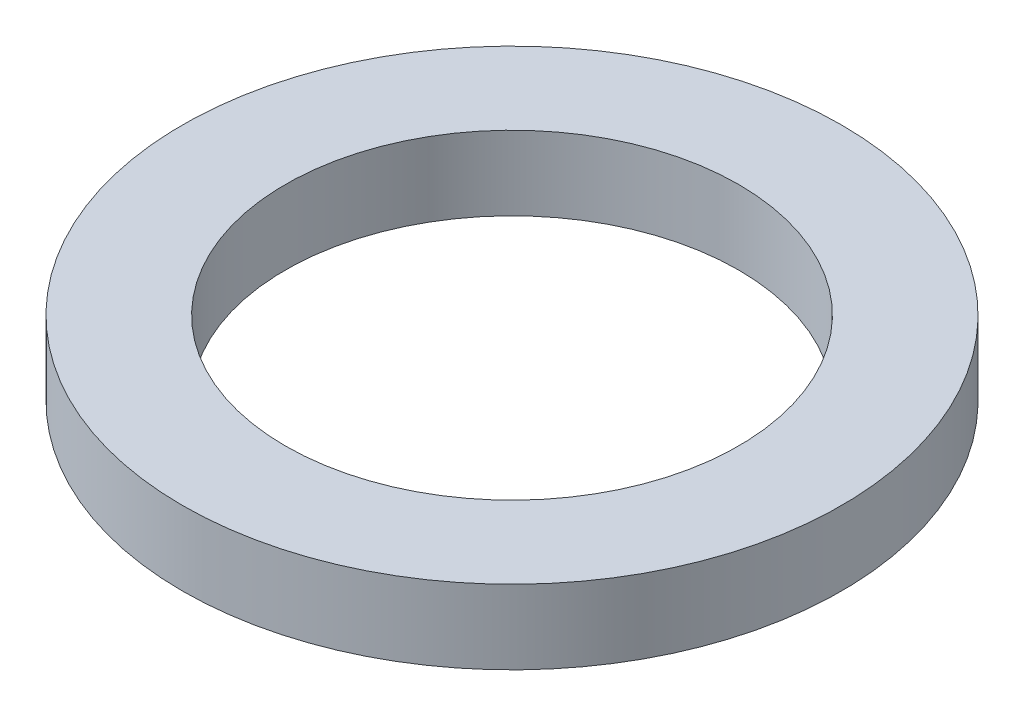
from build123d import *

# Parameters (mm, degrees)
SKETCH1_R           = 40
BOSS_EXTRUDE1_DEPTH = 9
SKETCH2_R           = 27.5
CUT_EXTRUDE1_DEPTH  = 58.280013966


with BuildPart() as part:
    # Sketch1 → Boss-Extrude1 (new body)
    with BuildSketch(Plane(origin=(0, 0, 0), x_dir=(1, 0, 0), z_dir=(0, 1, 0))):
        Circle(SKETCH1_R)
    extrude(amount=BOSS_EXTRUDE1_DEPTH)

    # Sketch2 → Cut-Extrude1 (cut, through all)
    with BuildSketch(Plane(origin=(0, 0, 0), x_dir=(1, 0, 0), z_dir=(0, 1, 0))):
        Circle(SKETCH2_R)
    extrude(amount=CUT_EXTRUDE1_DEPTH, mode=Mode.SUBTRACT)


solid = part.part
